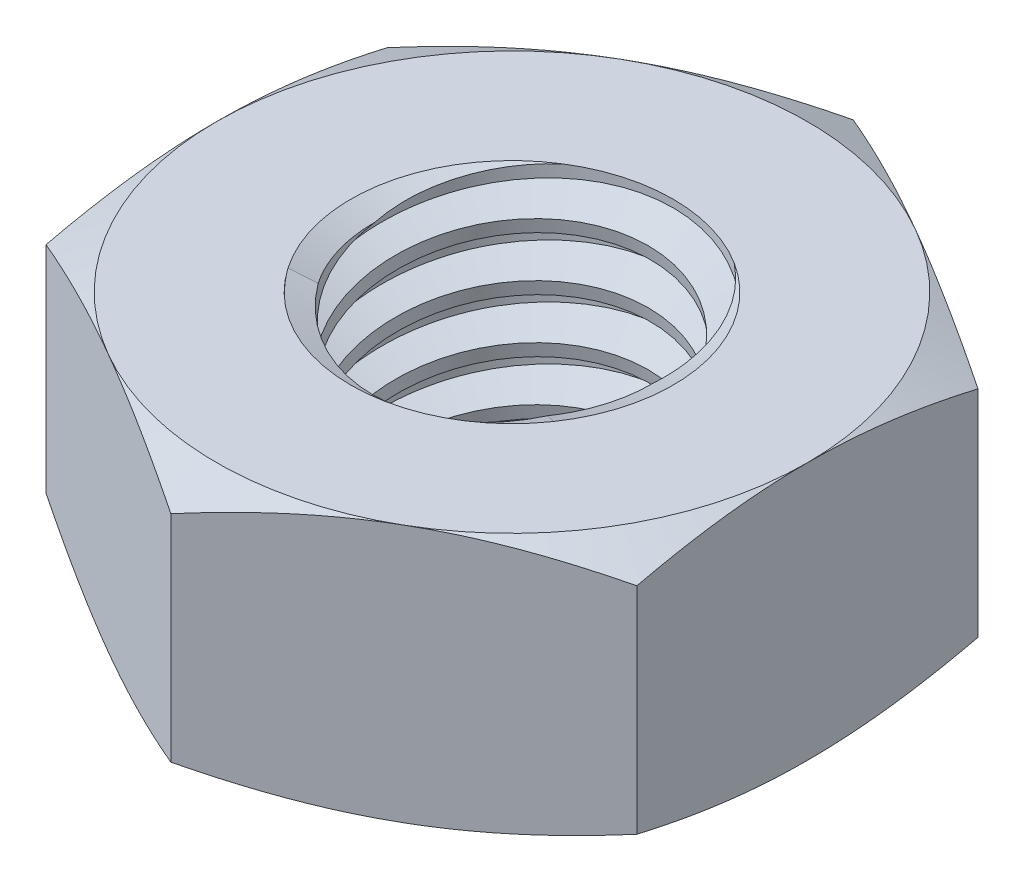
from build123d import *

# Parameters (mm, degrees)
EXTRUDE1_DEPTH       = 1.2
SKETCH2_W            = 1.5
SKETCH2_H            = 2.4
LPATTERN1_COUNT      = 5
LPATTERN1_PITCH      = 0.5
LPATTERN1_COUNT_DIR2 = 2
LPATTERN1_PITCH_DIR2 = 0.5


with BuildPart() as part:
    # Sketch1 → Extrude1 (new, symmetric)
    with BuildSketch(Plane(origin=(0, 0, 0), x_dir=(1, 0, 0), z_dir=(0, 1, 0))):
        Polygon((0, 3.175426481), (-2.75, 1.58771324), (-2.75, -1.58771324), (0, -3.175426481), (2.75, -1.58771324), (2.75, 1.58771324), align=None)
    extrude(amount=EXTRUDE1_DEPTH, both=True)

    # Sketch4 → Cut-Revolve2 (revolve, cut)
    with BuildSketch(Plane(origin=(0, 0, 0), x_dir=(0, 0, -1), z_dir=(1, 0, 0))):
        Polygon((0, 1.2), (1.5, 1.2), (1.269011592, 1.092288336), (1.269011592, -1.092288336), (1.5, -1.2), (0, -1.2), align=None)
    revolve(axis=Axis((0, 1.2, 0), (0, 1, 0)), mode=Mode.SUBTRACT)


with BuildPart() as body_2:
    # Sketch2 → Revolve1 (revolve)
    with BuildSketch(Plane(origin=(0, 0, 0), x_dir=(0, 0, -1), z_dir=(1, 0, 0))):
        with Locations((0.75, 0)):
            Rectangle(SKETCH2_W, SKETCH2_H)
    revolve(axis=Axis((0, -2.7, 0), (0, 1, 0)))

    # Sketch3 → Cut-Revolve1 (revolve, cut)
    with BuildSketch(Plane(origin=(0, 0, 0), x_dir=(0, 0, -1), z_dir=(1, 0, 0))):
        Polygon((1.510274937, 1.13835038), (1.582199494, 0.706803038), (1.289561466, 0.816435308), (1.269011592, 0.939734548), align=None)
    cut_revolve1 = revolve(axis=Axis((0, 1.2, 0.089188249), (0, -0.9863939238321437, -0.1643989873053576)), mode=Mode.SUBTRACT)

    # LPattern1: Cut-Revolve1 5 × 2
    with Locations(*[Vector(0, -1, 0) * (i * LPATTERN1_PITCH) + Vector(0, 1, 0) * (j * LPATTERN1_PITCH_DIR2) for i in range(LPATTERN1_COUNT) for j in range(LPATTERN1_COUNT_DIR2) if (i, j) != (0, 0)]):
        add(cut_revolve1, mode=Mode.SUBTRACT)


with BuildPart() as part_1:
    add(part.part)

    # Combine1: cut body 2
    add(body_2.part, mode=Mode.SUBTRACT)

    # Sketch5 → Cut-Revolve3 (revolve, cut)
    with BuildSketch(Plane(origin=(0, 0, 0), x_dir=(0, 0, -1), z_dir=(1, 0, 0))):
        Polygon((0, -1.2), (2.75, -1.2), (3.175426481, -1.001620374), (3.175426481, 1.001620374), (2.75, 1.2), (0, 1.2), (0, 2.47), (4.445426481, 2.47), (4.445426481, -2.47), (0, -2.47), align=None)
    revolve(axis=Axis((0, -1.2, 0), (0, 1, 0)), mode=Mode.SUBTRACT)


solid = part_1.part
